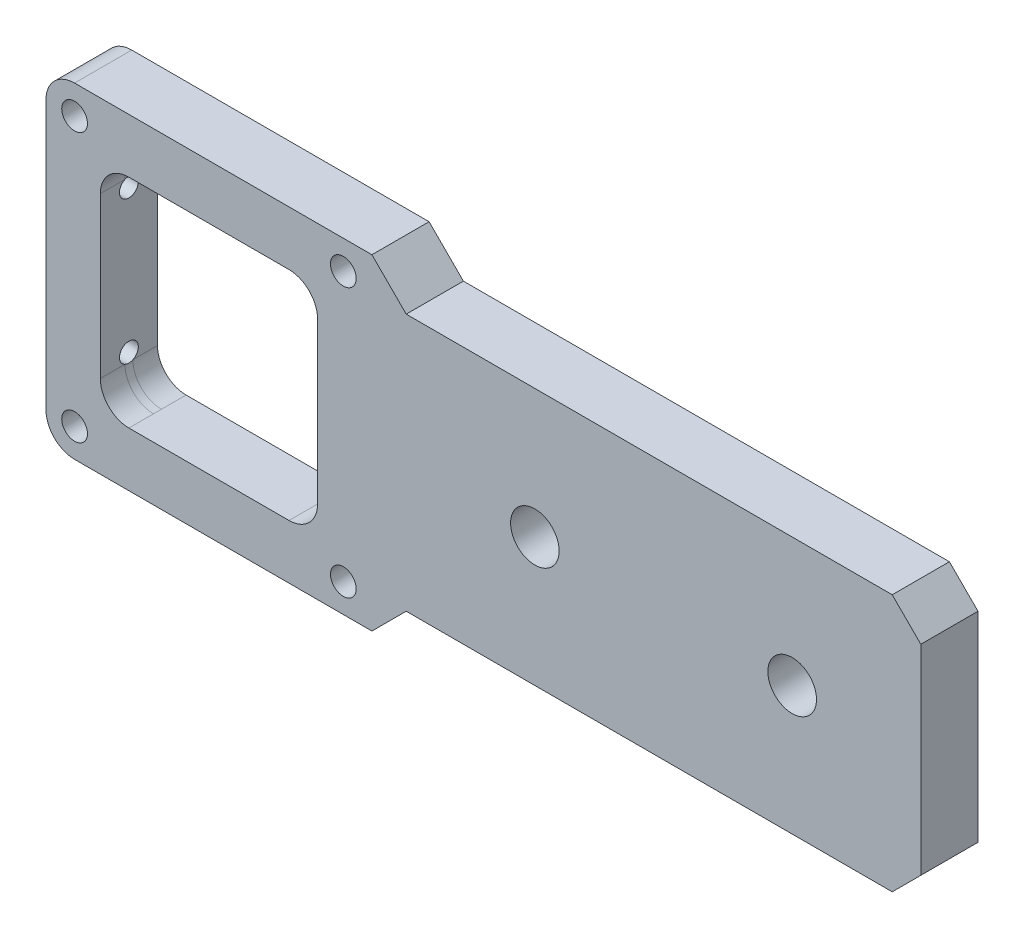
from build123d import *

# Parameters (mm, degrees)
EXTRUDE_1_DEPTH              = 5
SKETCH_6_R                   = 10
CUT_EXTRUDE_1530_DEPTH       = 10
SKETCH_19_R                  = 12
CUT_EXTRUDE_1946_DEPTH       = 5
HOLE_WIZARD_8_5_8_5_1_D      = 8.5
HOLE_WIZARD_1_D              = 4.5
HOLE_WIZARD_1_CBORE_D        = 8
HOLE_WIZARD_1_CBORE_DEPTH    = 4.6
FILLET_1_R                   = 5
CHAMFER_1_SIZE               = 5
CHAMFER_2_SIZE               = 0.2
HOLE_WIZARD_M4_1_D           = 3.3
HOLE_WIZARD_M4_1_DEPTH       = 15.5
HOLE_WIZARD_M4_1_CSINK_D     = 4.05
HOLE_WIZARD_M4_1_CSINK_ANGLE = 120
SKETCH_22_W                  = 38
SKETCH_22_H                  = 38
CUT_EXTRUDE_1_DEPTH          = 10
FILLET_2_R                   = 5


with BuildPart() as part:
    # 草图1 → 凸台-拉伸1 (new, symmetric)
    with BuildSketch(Plane.XY):
        Polygon((28.5, -28.5), (34.5, -22.5), (124.5, -22.5), (124.5, 22.5), (34.5, 22.5), (28.5, 28.5), (-28.5, 28.5), (-28.5, -28.5), align=None)
    extrude(amount=EXTRUDE_1_DEPTH, both=True)

    # 草图6 → Cut-Extrude 1530 (cut)
    with BuildSketch(Plane.XY.offset(5)):
        Circle(SKETCH_6_R)
    extrude(amount=-CUT_EXTRUDE_1530_DEPTH, mode=Mode.SUBTRACT)

    # 草图19 → Cut-Extrude 1946 (cut)
    with BuildSketch(Plane(origin=(0, 0, -5), x_dir=(-1, 0, 0), z_dir=(0, 0, -1))):
        Circle(SKETCH_19_R)
    extrude(amount=-CUT_EXTRUDE_1946_DEPTH, mode=Mode.SUBTRACT)

    # Ø8.5 (8.5) 直径孔1 (through all)
    with Locations(Plane.XY.offset(5)):
        with Locations((57, 0), (102, 0)):
            Hole(HOLE_WIZARD_8_5_8_5_1_D / 2)

    # 打孔尺寸(%根据)内六角圆柱头螺钉的类型1 (through all)
    with Locations(Plane(origin=(0, 0, -5), x_dir=(-1, 0, 0), z_dir=(0, 0, -1))):
        with Locations((-23.5, 23.5), (23.5, 23.5), (23.5, -23.5), (-23.5, -23.5)):
            CounterBoreHole(HOLE_WIZARD_1_D / 2, HOLE_WIZARD_1_CBORE_D / 2, HOLE_WIZARD_1_CBORE_DEPTH)

    # 圆角1
    fillet_1_edges = [part.edges().sort_by_distance(p)[0] for p in [
        (-28.5, 28.5, 0),
        (-28.5, -28.5, 0),
    ]]
    fillet(fillet_1_edges, radius=FILLET_1_R)

    # 倒角1
    chamfer_1_edges = [part.edges().sort_by_distance(p)[0] for p in [
        (124.5, 22.5, 0),
        (124.5, -22.5, 0),
    ]]
    chamfer(chamfer_1_edges, length=CHAMFER_1_SIZE)

    # 倒角2
    chamfer_2_edges = [part.edges().sort_by_distance(p)[0] for p in [
        (12, 0, -5),
    ]]
    chamfer(chamfer_2_edges, length=CHAMFER_2_SIZE)

    # M4 螺纹孔1
    with Locations(Plane.ZY.offset(28.5)):
        with Locations((0, 12.5), (0, -12.5)):
            CounterSinkHole(HOLE_WIZARD_M4_1_D / 2, HOLE_WIZARD_M4_1_CSINK_D / 2, depth=HOLE_WIZARD_M4_1_DEPTH, counter_sink_angle=HOLE_WIZARD_M4_1_CSINK_ANGLE)

    # 草图22 → 切除-拉伸1 (cut)
    with BuildSketch(Plane(origin=(0, 0, -5), x_dir=(-1, 0, 0), z_dir=(0, 0, -1))):
        Rectangle(SKETCH_22_W, SKETCH_22_H)
    extrude(amount=-CUT_EXTRUDE_1_DEPTH, mode=Mode.SUBTRACT)

    # 圆角2
    fillet_2_edges = [part.edges().sort_by_distance(p)[0] for p in [
        (19, -19, 0),
        (-19, -19, 0),
        (-19, 19, 0),
        (19, 19, 0),
    ]]
    fillet(fillet_2_edges, radius=FILLET_2_R)


solid = part.part
